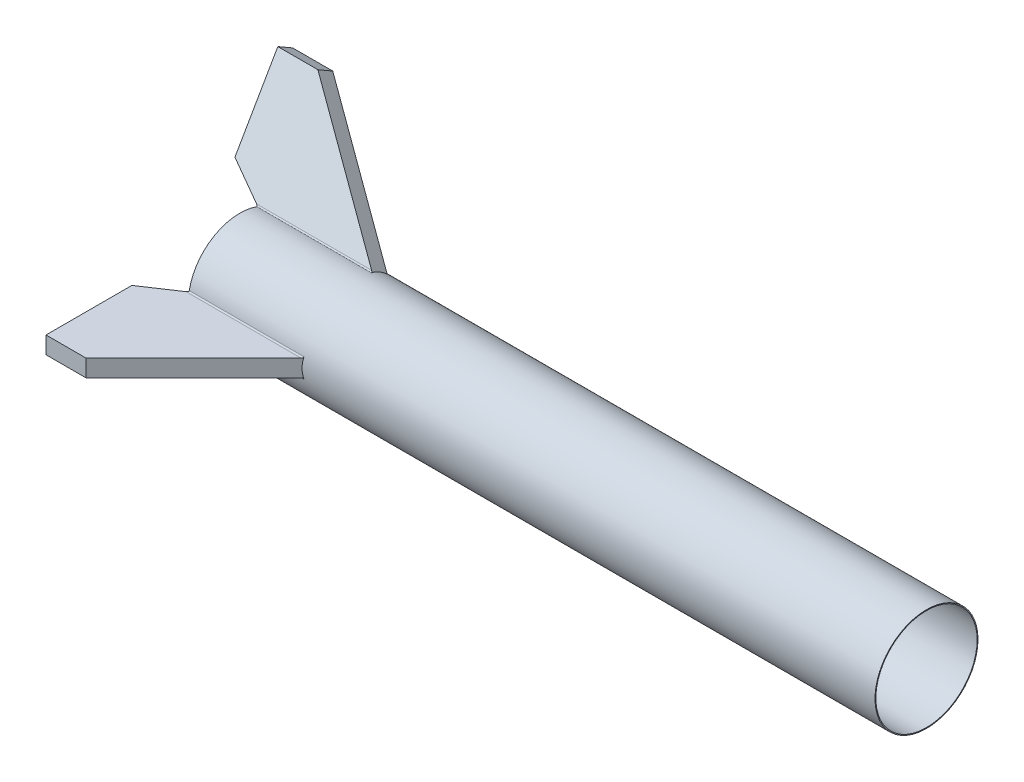
from build123d import *

# Parameters (mm, degrees)
BOSS_EXTRUDE1_DEPTH      = 30480
BOSS_EXTRUDE1_DEPTH_BACK = 30480
SKETCH1_R                = 4572
SHELL1_T                 = -76.2
LOFT2_START              = -762
LOFT2_DEPTH              = 1524
FILLET1_R                = 127
CIRPATTERN1_COUNT        = 3
FILLET1_OF_CIRPATTERN1_R = 127


# Read off the part's stored shape, not the designer's step: Loft2
with BuildPart() as part:
    # Sketch1 → Boss-Extrude1 (new, two sides: drawn at the far end of the back side and taken through both)
    with BuildSketch(Plane(origin=(0, 0, 0), x_dir=(0, 0, -1), z_dir=(1, 0, 0)).offset(-BOSS_EXTRUDE1_DEPTH_BACK)):
        Circle(SKETCH1_R)
    extrude(amount=BOSS_EXTRUDE1_DEPTH + BOSS_EXTRUDE1_DEPTH_BACK)

    # Shell1
    shell1_openings = [part.faces().sort_by_distance(p)[0] for p in [
        (-30480, 0, 0),
        (30480, 0, 0),
    ]]
    offset(amount=SHELL1_T, openings=shell1_openings, kind=Kind.INTERSECTION)

    # Loft2 outline → Loft2 (add)
    with BuildSketch(Plane(origin=(0, 0, 0), x_dir=(1, 0, 0), z_dir=(0, 1, 0)).offset(LOFT2_START)):
        Polygon((-30478.420807917, -4507), (-33528, -6540.052794722), (-33528, -14160.052794722), (-29972, -14160.052794722), (-20318.947205278, -4507), align=None)
    loft2 = extrude(amount=LOFT2_DEPTH)

    # Fillet1
    # the kernel refuses this fillet: 127 mm, written as the material it adds along each edge
    with BuildSketch(Plane(origin=(-30745.215862307, 762, 4508.052794722), x_dir=(0, 0.9840414147079701, -0.1779395800251785), z_dir=(1, 0, 0))) as fillet1_piece_1_section:
        with BuildLine():
            CenterArc((106.096300006, 126.991683602), FILLET1_R, 190.249769112, 79.094530003)
            Line((-18.876959662, 104.393356939), (0, 0))
            ThreePointArc((0, 0), (52.321463017, 0.299390324), (104.642926033, 0))
        make_face()
    fillet1_piece_1 = extrude(amount=10690.431724613, mode=Mode.PRIVATE)
    fillet1_piece_1 = split(fillet1_piece_1, bisect_by=Plane(origin=(-30480, 769.527173965, 4556.423529059), z_dir=(-1, 0, 0)), keep=Keep.TOP, mode=Mode.PRIVATE)
    fillet1_piece_1 = split(fillet1_piece_1, bisect_by=Plane(origin=(-30527.440527907, 769.527173965, 4539.679813327), z_dir=(0.5547001962252289, 0, 0.8320502943378439)), keep=Keep.TOP, mode=Mode.PRIVATE)
    add(fillet1_piece_1)
    with BuildSketch(Plane(origin=(-30480, 762, 4508.052794722), x_dir=(0, 0.9840414147079701, -0.17793958002517812), z_dir=(1, 0, 0))) as fillet1_piece_2_section:
        with BuildLine():
            CenterArc((106.096300006, 126.991683602), FILLET1_R, 190.249769112, 79.094530003)
            Line((-18.876959662, 104.393356939), (0, 0))
            ThreePointArc((0, 0), (52.321463017, 0.299390324), (104.642926033, 0))
        make_face()
    fillet1_piece_2 = extrude(amount=10425.215862307, mode=Mode.PRIVATE)
    fillet1_piece_2 = split(fillet1_piece_2, bisect_by=Plane(origin=(-30469.277434704, 825.457396933, 4500.904417858), z_dir=(-0.5547001962252289, 0, -0.8320502943378439)), keep=Keep.TOP, mode=Mode.PRIVATE)
    add(fillet1_piece_2)
    with BuildSketch(Plane(origin=(-30480, 762, 4508.052794722), x_dir=(0, 0.9840414147079701, -0.17793958002517812), z_dir=(1, 0, 0))) as fillet1_piece_3_section:
        with BuildLine():
            CenterArc((106.096300006, 126.991683602), FILLET1_R, 190.249769112, 79.094530003)
            Line((-18.876959662, 104.393356939), (0, 0))
            ThreePointArc((0, 0), (52.321463017, 0.299390324), (104.642926033, 0))
        make_face()
    fillet1_piece_3 = extrude(amount=10425.215862307, mode=Mode.PRIVATE)
    fillet1_piece_3 = split(fillet1_piece_3, bisect_by=Plane(origin=(-22874.041619901, 784.931098552, 7062.094414623), z_dir=(-0.7071067811865476, 0, -0.7071067811865476)), keep=Keep.TOP, mode=Mode.PRIVATE)
    fillet1_piece_3 = split(fillet1_piece_3, bisect_by=Plane(origin=(-26977.987627207, 784.931098552, 2173.377879526), z_dir=(0.5547001962252289, 0, 0.8320502943378439)), keep=Keep.TOP, mode=Mode.PRIVATE)
    add(fillet1_piece_3)
    with BuildSketch(Plane(origin=(-30745.215862307, -762, 4508.052794722), x_dir=(0, -0.9840414147079707, -0.17793958002517546), z_dir=(1, 0, 0))) as fillet1_piece_4_section:
        with BuildLine():
            CenterArc((106.096300006, -126.991683602), FILLET1_R, 90.655700885, 79.094530003)
            Line((-18.876959662, -104.393356939), (0, 0))
            ThreePointArc((0, 0), (52.321463017, -0.299390324), (104.642926033, 0))
        make_face()
    fillet1_piece_4 = extrude(amount=10690.431724613, mode=Mode.PRIVATE)
    fillet1_piece_4 = split(fillet1_piece_4, bisect_by=Plane(origin=(-30480, -769.527173965, 4556.423529059), z_dir=(-1, 0, 0)), keep=Keep.TOP, mode=Mode.PRIVATE)
    fillet1_piece_4 = split(fillet1_piece_4, bisect_by=Plane(origin=(-30527.440527907, -769.527173965, 4539.679813327), z_dir=(0.5547001962252289, 0, 0.8320502943378439)), keep=Keep.TOP, mode=Mode.PRIVATE)
    add(fillet1_piece_4)
    with BuildSketch(Plane(origin=(-30480, -762, 4508.052794722), x_dir=(0, -0.9840414147079704, -0.1779395800251768), z_dir=(1, 0, 0))) as fillet1_piece_5_section:
        with BuildLine():
            CenterArc((106.096300006, -126.991683602), FILLET1_R, 90.655700885, 79.094530003)
            Line((-18.876959662, -104.393356939), (0, 0))
            ThreePointArc((0, 0), (52.321463017, -0.299390324), (104.642926033, 0))
        make_face()
    fillet1_piece_5 = extrude(amount=10425.215862307, mode=Mode.PRIVATE)
    fillet1_piece_5 = split(fillet1_piece_5, bisect_by=Plane(origin=(-30469.277434704, -825.457396933, 4500.904417858), z_dir=(-0.5547001962252289, 0, -0.8320502943378439)), keep=Keep.TOP, mode=Mode.PRIVATE)
    add(fillet1_piece_5)
    with BuildSketch(Plane(origin=(-30480, -762, 4508.052794722), x_dir=(0, -0.9840414147079704, -0.1779395800251768), z_dir=(1, 0, 0))) as fillet1_piece_6_section:
        with BuildLine():
            CenterArc((106.096300006, -126.991683602), FILLET1_R, 90.655700885, 79.094530003)
            Line((-18.876959662, -104.393356939), (0, 0))
            ThreePointArc((0, 0), (52.321463017, -0.299390324), (104.642926033, 0))
        make_face()
    fillet1_piece_6 = extrude(amount=10425.215862307, mode=Mode.PRIVATE)
    fillet1_piece_6 = split(fillet1_piece_6, bisect_by=Plane(origin=(-22874.041619901, -784.931098552, 7062.094414623), z_dir=(-0.7071067811865476, 0, -0.7071067811865476)), keep=Keep.TOP, mode=Mode.PRIVATE)
    fillet1_piece_6 = split(fillet1_piece_6, bisect_by=Plane(origin=(-26977.987627207, -784.931098552, 2173.377879526), z_dir=(0.5547001962252289, 0, 0.8320502943378439)), keep=Keep.TOP, mode=Mode.PRIVATE)
    add(fillet1_piece_6)

    # CirPattern1: Loft2 ×3 about axis
    cirpattern1_axis = Axis((0, 0, 0), (1, 0, 0))
    for i in range(1, CIRPATTERN1_COUNT):
        add(loft2.rotate(cirpattern1_axis, i * 360 / CIRPATTERN1_COUNT))

    # Fillet1 of CirPattern1
    # the kernel refuses this fillet: 127 mm, written as the material it adds along each edge
    with BuildSketch(Plane(origin=(-20054.784137693, -4285.088241831, -1594.115039677), x_dir=(0, -0.33792051071345414, 0.9411746535256664), z_dir=(-1, 0, 0))) as fillet1_of_cirpattern1_piece_1_section:
        with BuildLine():
            CenterArc((106.096300006, -126.991683602), FILLET1_OF_CIRPATTERN1_R, 90.655700885, 79.094530003)
            Line((-18.876959662, -104.393356939), (0, 0))
            ThreePointArc((0, 0), (52.321463017, -0.299390324), (104.642926033, 0))
        make_face()
    fillet1_of_cirpattern1_piece_1 = extrude(amount=10425.215862307, mode=Mode.PRIVATE)
    fillet1_of_cirpattern1_piece_1 = split(fillet1_of_cirpattern1_piece_1, bisect_by=Plane(origin=(-22874.041619902, -6508.418716264, -2851.276935745), z_dir=(-0.7071067811865476, 0.6123724356957947, 0.3535533905932737)), keep=Keep.TOP, mode=Mode.PRIVATE)
    fillet1_of_cirpattern1_piece_1 = split(fillet1_of_cirpattern1_piece_1, bisect_by=Plane(origin=(-26977.987627207, -2274.666004969, -406.918668197), z_dir=(0.5547001962252289, -0.7205766921228924, -0.41602514716892186)), keep=Keep.TOP, mode=Mode.PRIVATE)
    add(fillet1_of_cirpattern1_piece_1)
    with BuildSketch(Plane(origin=(-20054.784137693, -4285.088241831, -1594.115039677), x_dir=(0, -0.33792051071345414, 0.9411746535256664), z_dir=(-1, 0, 0))) as fillet1_of_cirpattern1_piece_2_section:
        with BuildLine():
            CenterArc((106.096300006, -126.991683602), FILLET1_OF_CIRPATTERN1_R, 90.655700885, 79.094530003)
            Line((-18.876959662, -104.393356939), (0, 0))
            ThreePointArc((0, 0), (52.321463017, -0.299390324), (104.642926033, 0))
        make_face()
    fillet1_of_cirpattern1_piece_2 = extrude(amount=10690.431724613, mode=Mode.PRIVATE)
    fillet1_of_cirpattern1_piece_2 = split(fillet1_of_cirpattern1_piece_2, bisect_by=Plane(origin=(-30480, -4330.742113549, -1611.781682973), z_dir=(-1, 0, 0)), keep=Keep.TOP, mode=Mode.PRIVATE)
    fillet1_of_cirpattern1_piece_2 = split(fillet1_of_cirpattern1_piece_2, bisect_by=Plane(origin=(-30527.440527907, -4316.241630371, -1603.409825107), z_dir=(0.5547001962252289, -0.7205766921228924, -0.41602514716892186)), keep=Keep.TOP, mode=Mode.PRIVATE)
    add(fillet1_of_cirpattern1_piece_2)
    with BuildSketch(Plane(origin=(-20054.784137693, -4285.088241831, -1594.115039677), x_dir=(0, -0.33792051071345414, 0.9411746535256664), z_dir=(-1, 0, 0))) as fillet1_of_cirpattern1_piece_3_section:
        with BuildLine():
            CenterArc((106.096300006, -126.991683602), FILLET1_OF_CIRPATTERN1_R, 90.655700885, 79.094530003)
            Line((-18.876959662, -104.393356939), (0, 0))
            ThreePointArc((0, 0), (52.321463017, -0.299390324), (104.642926033, 0))
        make_face()
    fillet1_of_cirpattern1_piece_3 = extrude(amount=10425.215862307, mode=Mode.PRIVATE)
    fillet1_of_cirpattern1_piece_3 = split(fillet1_of_cirpattern1_piece_3, bisect_by=Plane(origin=(-30469.277434703, -4310.626264337, -1535.585133443), z_dir=(-0.5547001962252289, 0.7205766921228924, 0.41602514716892186)), keep=Keep.TOP, mode=Mode.PRIVATE)
    add(fillet1_of_cirpattern1_piece_3)
    with BuildSketch(Plane(origin=(-20054.784137693, -3523.088241831, -2913.937755045), x_dir=(0, 0.646120903994517, -0.7632350735004965), z_dir=(-1, 0, 0))) as fillet1_of_cirpattern1_piece_4_section:
        with BuildLine():
            CenterArc((106.096300006, 126.991683602), FILLET1_OF_CIRPATTERN1_R, 190.249769112, 79.094530003)
            Line((-18.876959662, 104.393356939), (0, 0))
            ThreePointArc((0, 0), (52.321463017, 0.299390324), (104.642926033, 0))
        make_face()
    fillet1_of_cirpattern1_piece_4 = extrude(amount=10425.215862307, mode=Mode.PRIVATE)
    fillet1_of_cirpattern1_piece_4 = split(fillet1_of_cirpattern1_piece_4, bisect_by=Plane(origin=(-22874.041619901, -5723.487617712, -4210.817478878), z_dir=(-0.7071067811865476, 0.6123724356957947, 0.3535533905932737)), keep=Keep.TOP, mode=Mode.PRIVATE)
    fillet1_of_cirpattern1_piece_4 = split(fillet1_of_cirpattern1_piece_4, bisect_by=Plane(origin=(-26977.987627206, -1489.734906417, -1766.45921133), z_dir=(0.5547001962252289, -0.7205766921228924, -0.41602514716892186)), keep=Keep.TOP, mode=Mode.PRIVATE)
    add(fillet1_of_cirpattern1_piece_4)
    with BuildSketch(Plane(origin=(-20054.784137693, -3523.088241831, -2913.937755045), x_dir=(0, 0.646120903994517, -0.7632350735004965), z_dir=(-1, 0, 0))) as fillet1_of_cirpattern1_piece_5_section:
        with BuildLine():
            CenterArc((106.096300006, 126.991683602), FILLET1_OF_CIRPATTERN1_R, 190.249769112, 79.094530003)
            Line((-18.876959662, 104.393356939), (0, 0))
            ThreePointArc((0, 0), (52.321463017, 0.299390324), (104.642926033, 0))
        make_face()
    fillet1_of_cirpattern1_piece_5 = extrude(amount=10690.431724613, mode=Mode.PRIVATE)
    fillet1_of_cirpattern1_piece_5 = split(fillet1_of_cirpattern1_piece_5, bisect_by=Plane(origin=(-30480, -3561.214939584, -2944.641846085), z_dir=(-1, 0, 0)), keep=Keep.TOP, mode=Mode.PRIVATE)
    fillet1_of_cirpattern1_piece_5 = split(fillet1_of_cirpattern1_piece_5, bisect_by=Plane(origin=(-30527.440527907, -3546.714456406, -2936.269988219), z_dir=(0.5547001962252289, -0.7205766921228924, -0.41602514716892186)), keep=Keep.TOP, mode=Mode.PRIVATE)
    add(fillet1_of_cirpattern1_piece_5)
    with BuildSketch(Plane(origin=(-20054.784137693, -3523.088241831, -2913.937755045), x_dir=(0, 0.646120903994517, -0.7632350735004965), z_dir=(-1, 0, 0))) as fillet1_of_cirpattern1_piece_6_section:
        with BuildLine():
            CenterArc((106.096300006, 126.991683602), FILLET1_OF_CIRPATTERN1_R, 190.249769112, 79.094530003)
            Line((-18.876959662, 104.393356939), (0, 0))
            ThreePointArc((0, 0), (52.321463017, 0.299390324), (104.642926033, 0))
        make_face()
    fillet1_of_cirpattern1_piece_6 = extrude(amount=10425.215862307, mode=Mode.PRIVATE)
    fillet1_of_cirpattern1_piece_6 = split(fillet1_of_cirpattern1_piece_6, bisect_by=Plane(origin=(-30469.277434703, -3485.168867404, -2965.319284414), z_dir=(-0.5547001962252289, 0.7205766921228924, 0.41602514716892186)), keep=Keep.TOP, mode=Mode.PRIVATE)
    add(fillet1_of_cirpattern1_piece_6)
    with BuildSketch(Plane(origin=(-20054.784137693, 3523.088241831, -2913.937755045), x_dir=(0, -0.6461209039945224, -0.7632350735004917), z_dir=(-1, 0, 0))) as fillet1_of_cirpattern1_piece_7_section:
        with BuildLine():
            CenterArc((106.096300006, -126.991683602), FILLET1_OF_CIRPATTERN1_R, 90.655700885, 79.094530003)
            Line((-18.876959662, -104.393356939), (0, 0))
            ThreePointArc((0, 0), (52.321463017, -0.299390324), (104.642926033, 0))
        make_face()
    fillet1_of_cirpattern1_piece_7 = extrude(amount=10425.215862307, mode=Mode.PRIVATE)
    fillet1_of_cirpattern1_piece_7 = split(fillet1_of_cirpattern1_piece_7, bisect_by=Plane(origin=(-22874.041619902, 5723.487617712, -4210.817478878), z_dir=(-0.7071067811865476, -0.6123724356957944, 0.3535533905932741)), keep=Keep.TOP, mode=Mode.PRIVATE)
    fillet1_of_cirpattern1_piece_7 = split(fillet1_of_cirpattern1_piece_7, bisect_by=Plane(origin=(-26977.987627207, 1489.734906417, -1766.45921133), z_dir=(0.5547001962252289, 0.7205766921228921, -0.41602514716892236)), keep=Keep.TOP, mode=Mode.PRIVATE)
    add(fillet1_of_cirpattern1_piece_7)
    with BuildSketch(Plane(origin=(-20054.784137693, 3523.088241831, -2913.937755045), x_dir=(0, -0.6461209039945224, -0.7632350735004917), z_dir=(-1, 0, 0))) as fillet1_of_cirpattern1_piece_8_section:
        with BuildLine():
            CenterArc((106.096300006, -126.991683602), FILLET1_OF_CIRPATTERN1_R, 90.655700885, 79.094530003)
            Line((-18.876959662, -104.393356939), (0, 0))
            ThreePointArc((0, 0), (52.321463017, -0.299390324), (104.642926033, 0))
        make_face()
    fillet1_of_cirpattern1_piece_8 = extrude(amount=10690.431724613, mode=Mode.PRIVATE)
    fillet1_of_cirpattern1_piece_8 = split(fillet1_of_cirpattern1_piece_8, bisect_by=Plane(origin=(-30480, 3561.214939584, -2944.641846085), z_dir=(-1, 0, 0)), keep=Keep.TOP, mode=Mode.PRIVATE)
    fillet1_of_cirpattern1_piece_8 = split(fillet1_of_cirpattern1_piece_8, bisect_by=Plane(origin=(-30527.440527907, 3546.714456406, -2936.269988219), z_dir=(0.5547001962252289, 0.7205766921228921, -0.41602514716892236)), keep=Keep.TOP, mode=Mode.PRIVATE)
    add(fillet1_of_cirpattern1_piece_8)
    with BuildSketch(Plane(origin=(-20054.784137693, 3523.088241831, -2913.937755045), x_dir=(0, -0.6461209039945224, -0.7632350735004917), z_dir=(-1, 0, 0))) as fillet1_of_cirpattern1_piece_9_section:
        with BuildLine():
            CenterArc((106.096300006, -126.991683602), FILLET1_OF_CIRPATTERN1_R, 90.655700885, 79.094530003)
            Line((-18.876959662, -104.393356939), (0, 0))
            ThreePointArc((0, 0), (52.321463017, -0.299390324), (104.642926033, 0))
        make_face()
    fillet1_of_cirpattern1_piece_9 = extrude(amount=10425.215862307, mode=Mode.PRIVATE)
    fillet1_of_cirpattern1_piece_9 = split(fillet1_of_cirpattern1_piece_9, bisect_by=Plane(origin=(-30469.277434703, 3485.168867404, -2965.319284414), z_dir=(-0.5547001962252289, -0.7205766921228921, 0.41602514716892236)), keep=Keep.TOP, mode=Mode.PRIVATE)
    add(fillet1_of_cirpattern1_piece_9)
    with BuildSketch(Plane(origin=(-20054.784137693, 4285.088241831, -1594.115039677), x_dir=(0, 0.33792051071345486, 0.9411746535256663), z_dir=(-1, 0, 0))) as fillet1_of_cirpattern1_piece_10_section:
        with BuildLine():
            CenterArc((106.096300006, 126.991683602), FILLET1_OF_CIRPATTERN1_R, 190.249769112, 79.094530003)
            Line((-18.876959662, 104.393356939), (0, 0))
            ThreePointArc((0, 0), (52.321463017, 0.299390324), (104.642926033, 0))
        make_face()
    fillet1_of_cirpattern1_piece_10 = extrude(amount=10425.215862307, mode=Mode.PRIVATE)
    fillet1_of_cirpattern1_piece_10 = split(fillet1_of_cirpattern1_piece_10, bisect_by=Plane(origin=(-22874.041619901, 6508.418716264, -2851.276935745), z_dir=(-0.7071067811865476, -0.6123724356957944, 0.3535533905932741)), keep=Keep.TOP, mode=Mode.PRIVATE)
    fillet1_of_cirpattern1_piece_10 = split(fillet1_of_cirpattern1_piece_10, bisect_by=Plane(origin=(-26977.987627207, 2274.666004969, -406.918668197), z_dir=(0.5547001962252289, 0.7205766921228921, -0.41602514716892236)), keep=Keep.TOP, mode=Mode.PRIVATE)
    add(fillet1_of_cirpattern1_piece_10)
    with BuildSketch(Plane(origin=(-20054.784137693, 4285.088241831, -1594.115039677), x_dir=(0, 0.33792051071345486, 0.9411746535256663), z_dir=(-1, 0, 0))) as fillet1_of_cirpattern1_piece_11_section:
        with BuildLine():
            CenterArc((106.096300006, 126.991683602), FILLET1_OF_CIRPATTERN1_R, 190.249769112, 79.094530003)
            Line((-18.876959662, 104.393356939), (0, 0))
            ThreePointArc((0, 0), (52.321463017, 0.299390324), (104.642926033, 0))
        make_face()
    fillet1_of_cirpattern1_piece_11 = extrude(amount=10690.431724613, mode=Mode.PRIVATE)
    fillet1_of_cirpattern1_piece_11 = split(fillet1_of_cirpattern1_piece_11, bisect_by=Plane(origin=(-30480, 4330.742113549, -1611.781682973), z_dir=(-1, 0, 0)), keep=Keep.TOP, mode=Mode.PRIVATE)
    fillet1_of_cirpattern1_piece_11 = split(fillet1_of_cirpattern1_piece_11, bisect_by=Plane(origin=(-30527.440527907, 4316.241630371, -1603.409825107), z_dir=(0.5547001962252289, 0.7205766921228921, -0.41602514716892236)), keep=Keep.TOP, mode=Mode.PRIVATE)
    add(fillet1_of_cirpattern1_piece_11)
    with BuildSketch(Plane(origin=(-20054.784137693, 4285.088241831, -1594.115039677), x_dir=(0, 0.33792051071345486, 0.9411746535256663), z_dir=(-1, 0, 0))) as fillet1_of_cirpattern1_piece_12_section:
        with BuildLine():
            CenterArc((106.096300006, 126.991683602), FILLET1_OF_CIRPATTERN1_R, 190.249769112, 79.094530003)
            Line((-18.876959662, 104.393356939), (0, 0))
            ThreePointArc((0, 0), (52.321463017, 0.299390324), (104.642926033, 0))
        make_face()
    fillet1_of_cirpattern1_piece_12 = extrude(amount=10425.215862307, mode=Mode.PRIVATE)
    fillet1_of_cirpattern1_piece_12 = split(fillet1_of_cirpattern1_piece_12, bisect_by=Plane(origin=(-30469.277434703, 4310.626264337, -1535.585133443), z_dir=(-0.5547001962252289, -0.7205766921228921, 0.41602514716892236)), keep=Keep.TOP, mode=Mode.PRIVATE)
    add(fillet1_of_cirpattern1_piece_12)


solid = part.part
